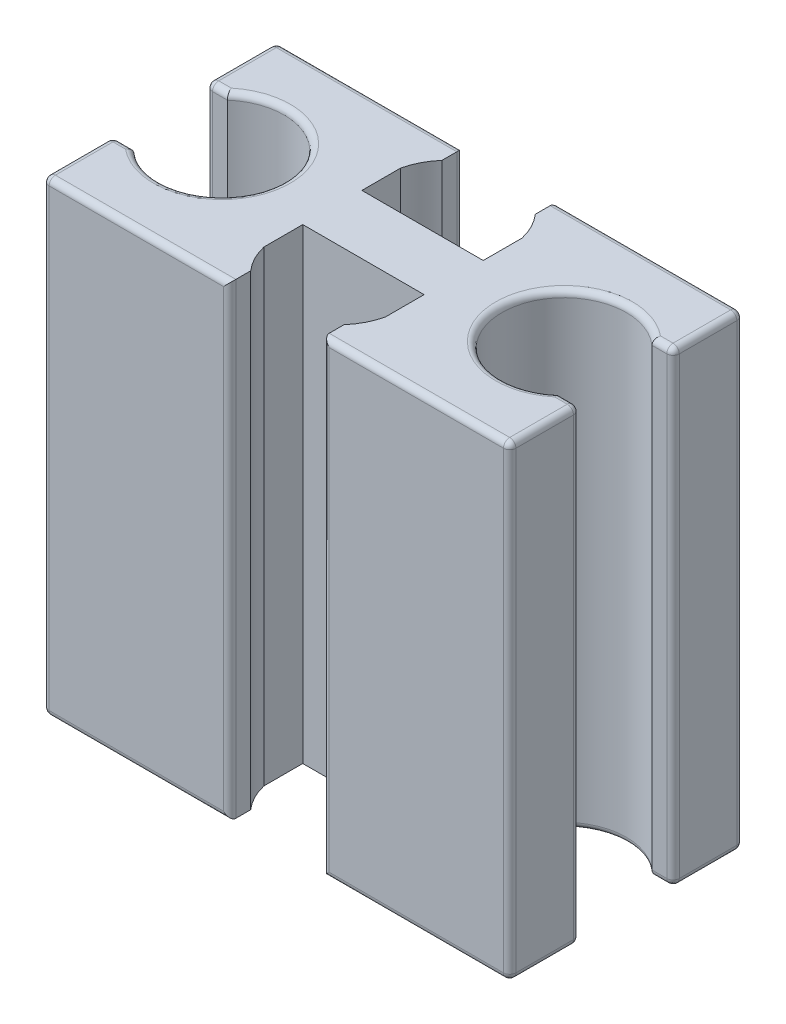
from build123d import *

# Parameters (mm, degrees)
EXTRUDE_1_DEPTH = 15
FILLET_1_R      = 0.2
FILLET_2_R      = 0.2


with BuildPart() as part:
    # 草图1 → 凸台-拉伸1 (new body)
    with BuildSketch(Plane(origin=(0, 0, 0), x_dir=(1, 0, 0), z_dir=(0, 1, 0))):
        with BuildLine():
            Line((-1.4999999999999998, 3.75), (-1.4999999999999998, 3.0728756555322954))
            ThreePointArc((-1.4999999999999998, 3.0728756555322954), (-1.7800423027536112, 2.6618384727612785), (-1.95, 2.1944097208657793))
            Line((-1.95, 2.1944097208657793), (-1.95, 0.95))
            Line((-1.95, 0.95), (1.9500000000000004, 0.9500000000000001))
            Line((1.9500000000000004, 0.9500000000000001), (1.9500000000000002, 2.194409720865779))
            ThreePointArc((1.9500000000000002, 2.194409720865779), (1.7800423027536114, 2.661838472761278), (1.5000000000000002, 3.072875655532295))
            Line((1.5000000000000002, 3.072875655532295), (1.4999999999999998, 3.75))
            Line((1.4999999999999998, 3.75), (7.5, 3.75))
            Line((7.5, 3.75), (7.5, 1.5))
            Line((7.5, 1.5), (6.822875655532296, 1.4999999999999998))
            ThreePointArc((6.822875655532296, 1.4999999999999998), (3.5, 2.4e-16), (6.822875655532294, -1.4999999999999996))
            Line((6.822875655532294, -1.4999999999999996), (7.5, -1.5))
            Line((7.5, -1.5), (7.5, -3.75))
            Line((7.5, -3.75), (1.4999999999999998, -3.75))
            Line((1.4999999999999998, -3.75), (1.5000000000000002, -3.072875655532295))
            ThreePointArc((1.5000000000000002, -3.072875655532295), (1.7800423027536114, -2.661838472761278), (1.9500000000000002, -2.194409720865779))
            Line((1.9500000000000002, -2.194409720865779), (1.9500000000000004, -0.9500000000000001))
            Line((1.9500000000000004, -0.9500000000000001), (-1.95, -0.95))
            Line((-1.95, -0.95), (-1.95, -2.1944097208657793))
            ThreePointArc((-1.95, -2.1944097208657793), (-1.7800423027536112, -2.6618384727612785), (-1.4999999999999998, -3.0728756555322954))
            Line((-1.4999999999999998, -3.0728756555322954), (-1.4999999999999998, -3.75))
            Line((-1.4999999999999998, -3.75), (-7.5, -3.75))
            Line((-7.5, -3.75), (-7.5, -1.5))
            Line((-7.5, -1.5), (-6.822875655532295, -1.5))
            ThreePointArc((-6.822875655532295, -1.5), (-3.5, 8.9e-16), (-6.822875655532296, 1.5))
            Line((-6.822875655532296, 1.5), (-7.5, 1.5))
            Line((-7.5, 1.5), (-7.5, 3.75))
            Line((-7.5, 3.75), (-1.4999999999999998, 3.75))
        make_face()
    extrude(amount=EXTRUDE_1_DEPTH)

    # 圆角1
    fillet_1_edges = [part.edges().sort_by_distance(p)[0] for p in [
        (-7.5, 0, -2.625),
        (-4.5, 0, -3.75),
        (4.5, 0, -3.75),
        (7.5, 0, -2.625),
        (7.5, 0, 2.625),
        (4.5, 0, 3.75),
        (4.5, 15, 3.75),
        (7.5, 15, 2.625),
        (-4.5, 0, 3.75),
        (-7.5, 0, 2.625),
        (-7.5, 15, 2.625),
        (-7.5, 7.5, 1.5),
        (-7.5, 7.5, -1.5),
        (-7.5, 7.5, -3.75),
        (-1.4999999999999998, 7.5, -3.75),
        (1.4999999999999998, 7.5, -3.75),
        (7.5, 7.5, -3.75),
        (7.5, 7.5, -1.5),
        (7.5, 7.5, 1.5),
        (7.5, 7.5, 3.75),
        (1.4999999999999998, 7.5, 3.75),
        (7.5, 15, -2.625),
        (-1.4999999999999998, 7.5, 3.75),
        (-7.5, 7.5, 3.75),
        (4.5, 15, -3.75),
        (-4.5, 15, 3.75),
        (-4.5, 15, -3.75),
        (-7.5, 15, -2.625),
    ]]
    fillet(fillet_1_edges, radius=FILLET_1_R)

    # 圆角2
    # the kernel refuses this fillet: 0.2 mm, written as the material it takes off along each edge
    with BuildSketch(Plane(origin=(-7.3, 14.8, 1.7), x_dir=(0, 0, -1), z_dir=(0, 1, 0))) as fillet_2_piece_1_section:
        Polygon((0, 0), (FILLET_2_R, 0), (FILLET_2_R, FILLET_2_R), (0, FILLET_2_R), align=None)
    fillet_2_piece_1 = extrude(amount=FILLET_2_R, mode=Mode.PRIVATE)
    fillet_2_piece_1 = fillet_2_piece_1 - Plane(origin=(-7.3, 14.8, 1.7), x_dir=(0.7071067811865475, 0, 0.7071067811865475), z_dir=(0, 1, 0)) * Sphere(FILLET_2_R, mode=Mode.PRIVATE)
    add(fillet_2_piece_1, mode=Mode.SUBTRACT)
    with BuildSketch(Plane(origin=(-7.3, 0.2, 1.7), x_dir=(0, 0, -1), z_dir=(0, -1, 0))) as fillet_2_piece_2_section:
        Polygon((0, 0), (FILLET_2_R, 0), (FILLET_2_R, -FILLET_2_R), (0, -FILLET_2_R), align=None)
    fillet_2_piece_2 = extrude(amount=FILLET_2_R, mode=Mode.PRIVATE)
    fillet_2_piece_2 = fillet_2_piece_2 - Plane(origin=(-7.3, 0.2, 1.7), x_dir=(0.7071067811865475, 0, 0.7071067811865475), z_dir=(0, -1, 0)) * Sphere(FILLET_2_R, mode=Mode.PRIVATE)
    add(fillet_2_piece_2, mode=Mode.SUBTRACT)
    with BuildSketch(Plane(origin=(-7.3, 0.2, -1.7), x_dir=(0, -1, 0), z_dir=(0, 0, 1))) as fillet_2_piece_3_section:
        Polygon((0, 0), (FILLET_2_R, 0), (FILLET_2_R, -FILLET_2_R), (0, -FILLET_2_R), align=None)
    fillet_2_piece_3 = extrude(amount=FILLET_2_R, mode=Mode.PRIVATE)
    fillet_2_piece_3 = fillet_2_piece_3 - Plane(origin=(-7.3, 0.2, -1.7), x_dir=(0.7071067811865475, 0.7071067811865475, 0), z_dir=(0, 0, 1)) * Sphere(FILLET_2_R, mode=Mode.PRIVATE)
    add(fillet_2_piece_3, mode=Mode.SUBTRACT)
    with BuildSketch(Plane(origin=(-7.3, 14.8, -1.7), x_dir=(0, 1, 0), z_dir=(0, 0, 1))) as fillet_2_piece_4_section:
        Polygon((0, 0), (FILLET_2_R, 0), (FILLET_2_R, FILLET_2_R), (0, FILLET_2_R), align=None)
    fillet_2_piece_4 = extrude(amount=FILLET_2_R, mode=Mode.PRIVATE)
    fillet_2_piece_4 = fillet_2_piece_4 - Plane(origin=(-7.3, 14.8, -1.7), x_dir=(0.7071067811865475, -0.7071067811865475, 0), z_dir=(0, 0, 1)) * Sphere(FILLET_2_R, mode=Mode.PRIVATE)
    add(fillet_2_piece_4, mode=Mode.SUBTRACT)
    with BuildSketch(Plane(origin=(7.3, 0.2, -1.7), x_dir=(3.3e-16, 0, 1), z_dir=(0, -1, 0))) as fillet_2_piece_5_section:
        Polygon((0, 0), (FILLET_2_R, 0), (FILLET_2_R, -FILLET_2_R), (7e-17, -FILLET_2_R), align=None)
    fillet_2_piece_5 = extrude(amount=FILLET_2_R, mode=Mode.PRIVATE)
    fillet_2_piece_5 = fillet_2_piece_5 - Plane(origin=(7.3, 0.2, -1.7), x_dir=(-0.7071067811865477, 0, -0.7071067811865475), z_dir=(0, -1, 0)) * Sphere(FILLET_2_R, mode=Mode.PRIVATE)
    add(fillet_2_piece_5, mode=Mode.SUBTRACT)
    with BuildSketch(Plane(origin=(7.3, 14.8, -1.7), x_dir=(3.3e-16, 0, 1), z_dir=(0, 1, 0))) as fillet_2_piece_6_section:
        Polygon((0, 0), (FILLET_2_R, 0), (FILLET_2_R, FILLET_2_R), (7e-17, FILLET_2_R), align=None)
    fillet_2_piece_6 = extrude(amount=FILLET_2_R, mode=Mode.PRIVATE)
    fillet_2_piece_6 = fillet_2_piece_6 - Plane(origin=(7.3, 14.8, -1.7), x_dir=(-0.7071067811865477, 0, -0.7071067811865475), z_dir=(0, 1, 0)) * Sphere(FILLET_2_R, mode=Mode.PRIVATE)
    add(fillet_2_piece_6, mode=Mode.SUBTRACT)
    with BuildSketch(Plane(origin=(7.3, 0.2, 1.6999999999999997), x_dir=(6.6e-16, 0, -1), z_dir=(0, -1, 0))) as fillet_2_piece_7_section:
        Polygon((0, 0), (FILLET_2_R, 0), (FILLET_2_R, FILLET_2_R), (1.3e-16, FILLET_2_R), align=None)
    fillet_2_piece_7 = extrude(amount=FILLET_2_R, mode=Mode.PRIVATE)
    fillet_2_piece_7 = fillet_2_piece_7 - Plane(origin=(7.3, 0.2, 1.6999999999999997), x_dir=(-0.7071067811865477, 0, 0.7071067811865472), z_dir=(0, -1, 0)) * Sphere(FILLET_2_R, mode=Mode.PRIVATE)
    add(fillet_2_piece_7, mode=Mode.SUBTRACT)
    with BuildSketch(Plane(origin=(7.3, 14.8, 1.6999999999999997), x_dir=(6.6e-16, 0, -1), z_dir=(0, 1, 0))) as fillet_2_piece_8_section:
        Polygon((0, 0), (FILLET_2_R, 0), (FILLET_2_R, -FILLET_2_R), (1.3e-16, -FILLET_2_R), align=None)
    fillet_2_piece_8 = extrude(amount=FILLET_2_R, mode=Mode.PRIVATE)
    fillet_2_piece_8 = fillet_2_piece_8 - Plane(origin=(7.3, 14.8, 1.6999999999999997), x_dir=(-0.7071067811865477, 0, 0.7071067811865472), z_dir=(0, 1, 0)) * Sphere(FILLET_2_R, mode=Mode.PRIVATE)
    add(fillet_2_piece_8, mode=Mode.SUBTRACT)
    with BuildSketch(Plane(origin=(-7.3, 0, 1.5), x_dir=(0, 0, 1), z_dir=(1, 0, 0))) as fillet_2_piece_9:
        with BuildLine():
            CenterArc((FILLET_2_R, -FILLET_2_R), FILLET_2_R, 90, 90)
            Line((0, -FILLET_2_R), (0, 0))
            Line((0, 0), (FILLET_2_R, 0))
        make_face()
    extrude(amount=0.9771243444677049, mode=Mode.SUBTRACT)
    with BuildSketch(Plane(origin=(-5.5, 0, -1.22e-15), x_dir=(-0.8269112079398366, 0, 0.5623325121167017), z_dir=(-0.5623325121167017, 0, -0.8269112079398366))) as fillet_2_piece_10:
        with BuildLine():
            CenterArc((2.0000000000000093 + FILLET_2_R, FILLET_2_R), FILLET_2_R, 180, 90)
            Line((2.0000000000000093, FILLET_2_R), (2.0000000000000093, 0))
            Line((2.0000000000000093, 0), (2.0000000000000093 + FILLET_2_R, 0))
        make_face()
    revolve(axis=Axis((-5.5, 0, -1.22e-15), (0, 1, 0)), revolution_arc=291.565479050289, mode=Mode.SUBTRACT)
    with BuildSketch(Plane(origin=(7.3, 0, -1.5), x_dir=(-3.3e-16, 0, -1), z_dir=(-1, 0, 3.3e-16))) as fillet_2_piece_11:
        with BuildLine():
            CenterArc((FILLET_2_R, -FILLET_2_R), FILLET_2_R, 90, 90)
            Line((0, -FILLET_2_R), (0, 0))
            Line((0, 0), (FILLET_2_R, 0))
        make_face()
    extrude(amount=0.977124344467704, mode=Mode.SUBTRACT)
    with BuildSketch(Plane(origin=(5.5, 0, -1.61e-15), x_dir=(0.8269112079398374, 0, -0.5623325121167005), z_dir=(0.5623325121167005, 0, 0.8269112079398374))) as fillet_2_piece_12:
        with BuildLine():
            CenterArc((2.0000000000000084 + FILLET_2_R, FILLET_2_R), FILLET_2_R, 180, 90)
            Line((2.0000000000000084, FILLET_2_R), (2.0000000000000084, 0))
            Line((2.0000000000000084, 0), (2.0000000000000084 + FILLET_2_R, 0))
        make_face()
    revolve(axis=Axis((5.5, 0, -1.61e-15), (0, 1, 0)), revolution_arc=291.565479050289, mode=Mode.SUBTRACT)
    with BuildSketch(Plane(origin=(5.5, 15, -1.61e-15), x_dir=(0.8269112079398374, 0, -0.5623325121167005), z_dir=(0.5623325121167005, 0, 0.8269112079398374))) as fillet_2_piece_13:
        with BuildLine():
            CenterArc((2.0000000000000084 + FILLET_2_R, -FILLET_2_R), FILLET_2_R, 90, 90)
            Line((2.0000000000000084, -FILLET_2_R), (2.0000000000000084, 0))
            Line((2.0000000000000084, 0), (2.0000000000000084 + FILLET_2_R, 0))
        make_face()
    revolve(axis=Axis((5.5, 15, -1.61e-15), (0, 1, 0)), revolution_arc=291.565479050289, mode=Mode.SUBTRACT)
    with BuildSketch(Plane(origin=(7.3, 15, -1.5), x_dir=(-3.3e-16, 0, -1), z_dir=(-1, 0, 3.3e-16))) as fillet_2_piece_14:
        with BuildLine():
            CenterArc((FILLET_2_R, FILLET_2_R), FILLET_2_R, 180, 90)
            Line((0, FILLET_2_R), (0, 0))
            Line((0, 0), (FILLET_2_R, 0))
        make_face()
    extrude(amount=0.977124344467704, mode=Mode.SUBTRACT)
    with BuildSketch(Plane(origin=(6.322875655532294, 15, 1.4999999999999993), x_dir=(-6.6e-16, 0, 1), z_dir=(1, 0, 6.6e-16))) as fillet_2_piece_15:
        with BuildLine():
            CenterArc((FILLET_2_R, FILLET_2_R), FILLET_2_R, 180, 90)
            Line((0, FILLET_2_R), (0, 0))
            Line((0, 0), (FILLET_2_R, 0))
        make_face()
    extrude(amount=0.9771243444677058, mode=Mode.SUBTRACT)
    with BuildSketch(Plane(origin=(-6.322875655532296, 15, -1.5), x_dir=(0, -1, 0), z_dir=(-1, 0, 0))) as fillet_2_piece_16:
        with BuildLine():
            CenterArc((FILLET_2_R, -FILLET_2_R), FILLET_2_R, 90, 90)
            Line((0, -FILLET_2_R), (0, 0))
            Line((0, 0), (FILLET_2_R, 0))
        make_face()
    extrude(amount=0.977124344467704, mode=Mode.SUBTRACT)
    with BuildSketch(Plane(origin=(-5.5, 15, -1.22e-15), x_dir=(-0.8269112079398366, 0, 0.5623325121167017), z_dir=(-0.5623325121167017, 0, -0.8269112079398366))) as fillet_2_piece_17:
        with BuildLine():
            CenterArc((2.000000000000001 + FILLET_2_R, -FILLET_2_R), FILLET_2_R, 89.99999999999987, 90.00000000000011)
            Line((2.000000000000001 + FILLET_2_R, 0), (2.000000000000001, 0))
            Line((2.000000000000001, 0), (2.0000000000000004, -FILLET_2_R))
        make_face()
    revolve(axis=Axis((-5.5, 15, -1.22e-15), (0, 1, 0)), revolution_arc=291.565479050289, mode=Mode.SUBTRACT)
    with BuildSketch(Plane(origin=(-6.322875655532296, 0, -1.5), x_dir=(0, 1, 0), z_dir=(-1, 0, 0))) as fillet_2_piece_18:
        with BuildLine():
            CenterArc((FILLET_2_R, FILLET_2_R), FILLET_2_R, 180, 90)
            Line((-3e-17, FILLET_2_R), (0, 0))
            Line((0, 0), (FILLET_2_R, 0))
        make_face()
    extrude(amount=0.977124344467704, mode=Mode.SUBTRACT)
    with BuildSketch(Plane(origin=(-7.3, 15, 1.5), x_dir=(0, 0, 1), z_dir=(1, 0, 0))) as fillet_2_piece_19:
        with BuildLine():
            CenterArc((FILLET_2_R, FILLET_2_R), FILLET_2_R, 180, 90)
            Line((0, FILLET_2_R), (0, 0))
            Line((0, 0), (FILLET_2_R, 0))
        make_face()
    extrude(amount=0.9771243444677049, mode=Mode.SUBTRACT)
    with BuildSketch(Plane(origin=(6.322875655532294, 0, 1.4999999999999993), x_dir=(-6.6e-16, 0, 1), z_dir=(1, 0, 6.6e-16))) as fillet_2_piece_20:
        with BuildLine():
            CenterArc((FILLET_2_R, -FILLET_2_R), FILLET_2_R, 90, 90)
            Line((0, -FILLET_2_R), (0, 0))
            Line((0, 0), (FILLET_2_R, 0))
        make_face()
    extrude(amount=0.9771243444677058, mode=Mode.SUBTRACT)


solid = part.part
